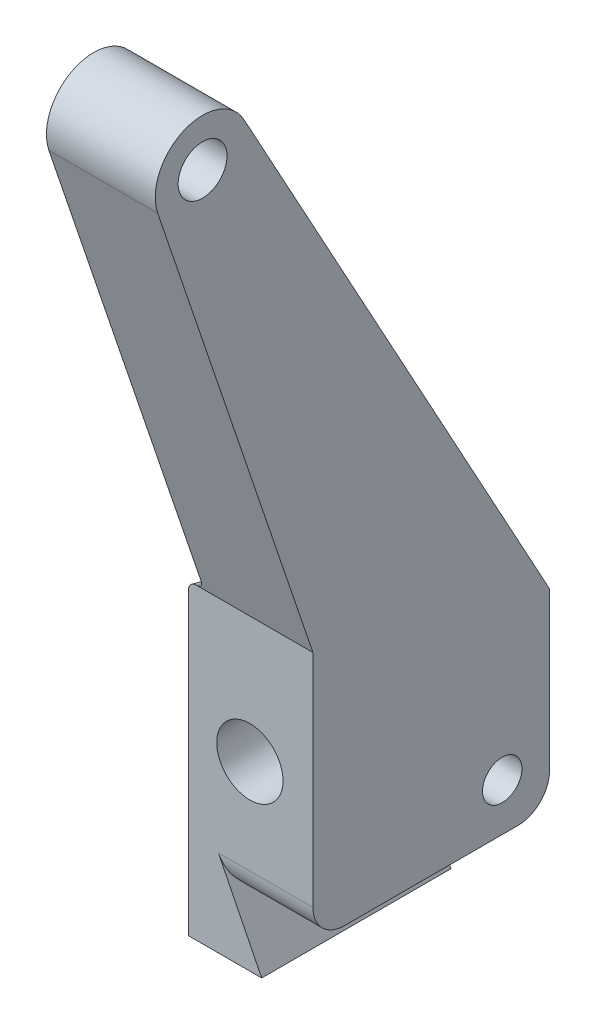
from build123d import *

# Parameters (mm, degrees)
SKETCH1_R             = 1.55
BOSS_EXTRUDE1_DEPTH   = 7.9
CUT_EXTRUDE2_DEPTH    = 60.130449009
M3X0_5_TAPPED_HOLE1_D = 2.5
SKETCH7_W             = 8
SKETCH7_H             = 0.5
CUT_EXTRUDE3_DEPTH    = 60.130449009
SKETCH8_R             = 2.1
CUT_EXTRUDE4_DEPTH    = 56.645395137
CUT_EXTRUDE5_DEPTH    = 3
CUT_EXTRUDE6_DEPTH    = 1
FILLET4_R             = 0.5
FILLET5_R             = 2


with BuildPart() as part:
    # Sketch1 → Boss-Extrude1 (new body)
    with BuildSketch(Plane(origin=(0, 0, 0), x_dir=(0, 0, -1), z_dir=(1, 0, 0))):
        with BuildLine():
            Line((0, 0), (0, 16))
            Line((0, 16), (-19.367478425, 51.438690431))
            ThreePointArc((-19.367478425, 51.438690431), (-23.205351274, 52.747203725), (-24.84125158, 49.037041298))
            Line((-24.84125158, 49.037041298), (-15, 20))
            Line((-15, 20), (-15, 0))
            Line((-15, 0), (0, 0))
        make_face()
        with Locations((-22, 50)):
            Circle(SKETCH1_R, mode=Mode.SUBTRACT)
    extrude(amount=BOSS_EXTRUDE1_DEPTH)

    # Sketch3 → Cut-Extrude2 (cut, through all)
    with BuildSketch(Plane(origin=(0, 0, 0), x_dir=(-1, 0, 0), z_dir=(0, 0, -1))):
        Polygon((-7.9, 0), (-4.9, 0), (-2.9, 4), (-7.9, 4), align=None)
    extrude(amount=-CUT_EXTRUDE2_DEPTH, mode=Mode.SUBTRACT)

    # M3x0.5 Tapped Hole1 (through all)
    with Locations(Plane(origin=(7.9, 7, 3), x_dir=(0, 0, 1), z_dir=(1, 0, 0))):
        with Locations((0, 0)):
            Hole(M3X0_5_TAPPED_HOLE1_D / 2)

    # Sketch7 → Cut-Extrude3 (cut, through all)
    with BuildSketch(Plane(origin=(0, 0, 0), x_dir=(-1, 0, 0), z_dir=(0, 0, -1))):
        with Locations((-4, 0.25)):
            Rectangle(SKETCH7_W, SKETCH7_H)
    extrude(amount=-CUT_EXTRUDE3_DEPTH, mode=Mode.SUBTRACT)

    # Sketch8 → Cut-Extrude4 (cut, through all)
    with BuildSketch(Plane.XY.offset(15)):
        with Locations((3.9, 12)):
            Circle(SKETCH8_R)
    extrude(amount=-CUT_EXTRUDE4_DEPTH, mode=Mode.SUBTRACT)

    # Sketch9 → Cut-Extrude5 (cut)
    with BuildSketch(Plane(origin=(0, 0, 0), x_dir=(-1, 0, 0), z_dir=(0, 0, -1))):
        Polygon((-4.65, 0.5), (-2.9, 4), (0, 4), (0, 0.5), align=None)
    extrude(amount=-CUT_EXTRUDE5_DEPTH, mode=Mode.SUBTRACT)

    # Sketch11 → Cut-Extrude6 (cut)
    with BuildSketch(Plane.ZY):
        with BuildLine():
            Line((0, 16), (15, 20))
            Line((15, 20), (24.84125158, 49.037041298))
            ThreePointArc((24.84125158, 49.037041298), (23.205351274, 52.747203725), (19.367478425, 51.438690431))
            Line((19.367478425, 51.438690431), (0, 16))
        make_face()
    extrude(amount=-CUT_EXTRUDE6_DEPTH, mode=Mode.SUBTRACT)

    # Fillet4
    fillet4_edges = [part.edges().sort_by_distance(p)[0] for p in [
        (1, 18, 7.5),
        (0, 18, 7.5),
    ]]
    fillet(fillet4_edges, radius=FILLET4_R - 0.0001)  # a hair under: the kernel refuses the full size

    # Fillet5
    fillet5_edges = [part.edges().sort_by_distance(p)[0] for p in [
        (5.4, 4, 15),
        (3.95, 4, 0),
    ]]
    fillet(fillet5_edges, radius=FILLET5_R)


solid = part.part
